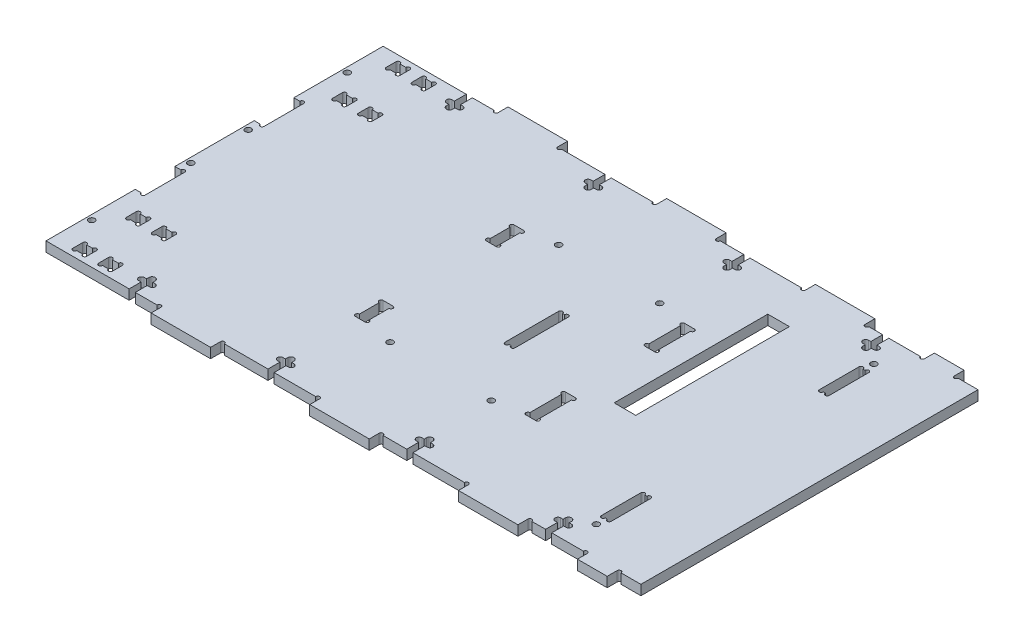
from build123d import *

# Parameters (mm, degrees)
SKETCH_1_W           = 300
SKETCH_1_H           = 170
EXTRUDE_1_DEPTH      = 5
SKETCH_2_W           = 5
SKETCH_2_H           = 27
SKETCH_2_H_2         = 20
CUT_EXTRUDE_1_DEPTH  = 10
SKETCH_3_R           = 1.55
CUT_EXTRUDE_2_DEPTH  = 10
SKETCH_4_W           = 5
SKETCH_4_H           = 20
CUT_EXTRUDE_3_DEPTH  = 5
SKETCH_5_R           = 1
CUT_EXTRUDE_4_DEPTH  = 10
SKETCH_8_W           = 30
SKETCH_8_H           = 5
SKETCH_8_W_2         = 15
EXTRUDE_2_DEPTH      = 5
SKETCH_9_R           = 1
CUT_EXTRUDE_6_DEPTH  = 5
SKETCH_13_W          = 7
SKETCH_13_H          = 5
CUT_EXTRUDE_9_DEPTH  = 10
SKETCH_14_R          = 1
CUT_EXTRUDE_10_DEPTH = 10
SKETCH_15_W          = 5
SKETCH_15_H          = 14
SKETCH_15_H_2        = 20
CUT_EXTRUDE_11_DEPTH = 10
SKETCH_16_R          = 1
CUT_EXTRUDE_12_DEPTH = 10
SKETCH_17_W          = 10.9
SKETCH_17_H          = 77.5
CUT_EXTRUDE_13_DEPTH = 10
CUT_EXTRUDE_5_DEPTH  = 10
SKETCH_18_R          = 6
CUT_EXTRUDE_14_DEPTH = 1.5


with BuildPart() as part:
    # 스케치1 → 보스-돌출1 (new body)
    with BuildSketch(Plane(origin=(0, 0, 0), x_dir=(1, 0, 0), z_dir=(0, 1, 0))):
        with Locations((150, 85)):
            Rectangle(SKETCH_1_W, SKETCH_1_H)
    extrude(amount=EXTRUDE_1_DEPTH)

    # 스케치2 → 컷-돌출1 (cut)
    with BuildSketch(Plane.XZ):
        with Locations((162.5, -85)):
            Rectangle(SKETCH_2_W, SKETCH_2_H)
        with Locations((262.5, -30)):
            Rectangle(SKETCH_2_W, SKETCH_2_H_2)
        with Locations((262.5, -140)):
            Rectangle(SKETCH_2_W, SKETCH_2_H_2)
    extrude(amount=-CUT_EXTRUDE_1_DEPTH, mode=Mode.SUBTRACT)

    # 스케치3 → 컷-돌출2 (cut)
    with BuildSketch(Plane(origin=(0, 5, 0), x_dir=(1, 0, 0), z_dir=(0, 1, 0))):
        with Locations((131, 127.5)):
            Circle(SKETCH_3_R)
        with Locations((182, 127.5)):
            Circle(SKETCH_3_R)
        with Locations((182, 42.5)):
            Circle(SKETCH_3_R)
        with Locations((131, 42.5)):
            Circle(SKETCH_3_R)
        with Locations((2.5, 70.55)):
            Circle(SKETCH_3_R)
        with Locations((2.5, 20.55)):
            Circle(SKETCH_3_R)
        with Locations((2.5, 99.45)):
            Circle(SKETCH_3_R)
        with Locations((2.5, 149.45)):
            Circle(SKETCH_3_R)
        with Locations((262.5, 155)):
            Circle(SKETCH_3_R)
        with Locations((262.5, 15)):
            Circle(SKETCH_3_R)
    extrude(amount=-CUT_EXTRUDE_2_DEPTH, mode=Mode.SUBTRACT)

    # 스케치4 → 컷-돌출3 (cut)
    with BuildSketch(Plane.XZ):
        with Locations((2.5, -115)):
            Rectangle(SKETCH_4_W, SKETCH_4_H)
        with Locations((2.5, -55)):
            Rectangle(SKETCH_4_W, SKETCH_4_H)
    extrude(amount=-CUT_EXTRUDE_3_DEPTH, mode=Mode.SUBTRACT)

    # 스케치5 → 컷-돌출4 (cut)
    with BuildSketch(Plane.XZ):
        with Locations((4, -45)):
            Circle(SKETCH_5_R)
        with Locations((4, -65)):
            Circle(SKETCH_5_R)
        with Locations((4, -105)):
            Circle(SKETCH_5_R)
        with Locations((4, -125)):
            Circle(SKETCH_5_R)
        with Locations((164, -98.5)):
            Circle(SKETCH_5_R)
        with Locations((161, -98.5)):
            Circle(SKETCH_5_R)
        with Locations((164, -71.5)):
            Circle(SKETCH_5_R)
        with Locations((161, -71.5)):
            Circle(SKETCH_5_R)
        with Locations((264, -20)):
            Circle(SKETCH_5_R)
        with Locations((261, -20)):
            Circle(SKETCH_5_R)
        with Locations((264, -40)):
            Circle(SKETCH_5_R)
        with Locations((261, -40)):
            Circle(SKETCH_5_R)
        with Locations((264, -130)):
            Circle(SKETCH_5_R)
        with Locations((261, -130)):
            Circle(SKETCH_5_R)
        with Locations((264, -150)):
            Circle(SKETCH_5_R)
        with Locations((261, -150)):
            Circle(SKETCH_5_R)
    extrude(amount=-CUT_EXTRUDE_4_DEPTH, mode=Mode.SUBTRACT)

    # 스케치8 → 보스-돌출2 (add)
    with BuildSketch(Plane.XZ):
        with Locations((73, 2.5)):
            Rectangle(SKETCH_8_W, SKETCH_8_H)
        with Locations((153, 2.5)):
            Rectangle(SKETCH_8_W, SKETCH_8_H)
        with Locations((228, 2.5)):
            Rectangle(SKETCH_8_W, SKETCH_8_H)
        with Locations((280.5, 2.5)):
            Rectangle(SKETCH_8_W_2, SKETCH_8_H)
        with Locations((280.5, -172.5)):
            Rectangle(SKETCH_8_W_2, SKETCH_8_H)
        with Locations((228, -172.5)):
            Rectangle(SKETCH_8_W, SKETCH_8_H)
        with Locations((153, -172.5)):
            Rectangle(SKETCH_8_W, SKETCH_8_H)
        with Locations((73, -172.5)):
            Rectangle(SKETCH_8_W, SKETCH_8_H)
    extrude(amount=-EXTRUDE_2_DEPTH)

    # 스케치9 → 컷-돌출6 (cut)
    with BuildSketch(Plane.XZ):
        with Locations((57, 0)):
            Circle(SKETCH_9_R)
        with Locations((89, 0)):
            Circle(SKETCH_9_R)
        with Locations((137, 0)):
            Circle(SKETCH_9_R)
        with Locations((169, 0)):
            Circle(SKETCH_9_R)
        with Locations((212, 0)):
            Circle(SKETCH_9_R)
        with Locations((272, 0)):
            Circle(SKETCH_9_R)
        with Locations((244, 0)):
            Circle(SKETCH_9_R)
        with Locations((289, 0)):
            Circle(SKETCH_9_R)
        with Locations((289, -170)):
            Circle(SKETCH_9_R)
        with Locations((244, -170)):
            Circle(SKETCH_9_R)
        with Locations((272, -170)):
            Circle(SKETCH_9_R)
        with Locations((212, -170)):
            Circle(SKETCH_9_R)
        with Locations((169, -170)):
            Circle(SKETCH_9_R)
        with Locations((137, -170)):
            Circle(SKETCH_9_R)
        with Locations((89, -170)):
            Circle(SKETCH_9_R)
        with Locations((57, -170)):
            Circle(SKETCH_9_R)
    extrude(amount=-CUT_EXTRUDE_6_DEPTH, mode=Mode.SUBTRACT)

    # 스케치13 → 컷-돌출9 (cut)
    with BuildSketch(Plane(origin=(0, 5, 0), x_dir=(1, 0, 0), z_dir=(0, 1, 0))):
        with Locations((26.5, 6)):
            Rectangle(SKETCH_13_W, SKETCH_13_H)
        with Locations((13.5, 6)):
            Rectangle(SKETCH_13_W, SKETCH_13_H)
        with Locations((13.5, 33)):
            Rectangle(SKETCH_13_W, SKETCH_13_H)
        with Locations((26.5, 33)):
            Rectangle(SKETCH_13_W, SKETCH_13_H)
        with Locations((26.5, 137)):
            Rectangle(SKETCH_13_W, SKETCH_13_H)
        with Locations((13.5, 137)):
            Rectangle(SKETCH_13_W, SKETCH_13_H)
        with Locations((13.5, 164)):
            Rectangle(SKETCH_13_W, SKETCH_13_H)
        with Locations((26.5, 164)):
            Rectangle(SKETCH_13_W, SKETCH_13_H)
    extrude(amount=-CUT_EXTRUDE_9_DEPTH, mode=Mode.SUBTRACT)

    # 스케치14 → 컷-돌출10 (cut)
    with BuildSketch(Plane.XZ):
        with Locations((11, -8.5)):
            Circle(SKETCH_14_R)
        with Locations((11, -3.5)):
            Circle(SKETCH_14_R)
        with Locations((16, -3.5)):
            Circle(SKETCH_14_R)
        with Locations((16, -8.5)):
            Circle(SKETCH_14_R)
        with Locations((24, -8.5)):
            Circle(SKETCH_14_R)
        with Locations((24, -3.5)):
            Circle(SKETCH_14_R)
        with Locations((29, -3.5)):
            Circle(SKETCH_14_R)
        with Locations((29, -8.5)):
            Circle(SKETCH_14_R)
        with Locations((29, -30.5)):
            Circle(SKETCH_14_R)
        with Locations((29, -35.5)):
            Circle(SKETCH_14_R)
        with Locations((24, -35.5)):
            Circle(SKETCH_14_R)
        with Locations((24, -30.5)):
            Circle(SKETCH_14_R)
        with Locations((16, -30.5)):
            Circle(SKETCH_14_R)
        with Locations((16, -35.5)):
            Circle(SKETCH_14_R)
        with Locations((11, -35.5)):
            Circle(SKETCH_14_R)
        with Locations((11, -30.5)):
            Circle(SKETCH_14_R)
        with Locations((11, -139.5)):
            Circle(SKETCH_14_R)
        with Locations((11, -134.5)):
            Circle(SKETCH_14_R)
        with Locations((16, -134.5)):
            Circle(SKETCH_14_R)
        with Locations((16, -139.5)):
            Circle(SKETCH_14_R)
        with Locations((24, -139.5)):
            Circle(SKETCH_14_R)
        with Locations((24, -134.5)):
            Circle(SKETCH_14_R)
        with Locations((29, -134.5)):
            Circle(SKETCH_14_R)
        with Locations((29, -139.5)):
            Circle(SKETCH_14_R)
        with Locations((29, -161.5)):
            Circle(SKETCH_14_R)
        with Locations((29, -166.5)):
            Circle(SKETCH_14_R)
        with Locations((24, -166.5)):
            Circle(SKETCH_14_R)
        with Locations((24, -161.5)):
            Circle(SKETCH_14_R)
        with Locations((16, -161.5)):
            Circle(SKETCH_14_R)
        with Locations((16, -166.5)):
            Circle(SKETCH_14_R)
        with Locations((11, -166.5)):
            Circle(SKETCH_14_R)
        with Locations((11, -161.5)):
            Circle(SKETCH_14_R)
    extrude(amount=-CUT_EXTRUDE_10_DEPTH, mode=Mode.SUBTRACT)

    # 스케치15 → 컷-돌출11 (cut)
    with BuildSketch(Plane(origin=(0, 5, 0), x_dir=(1, 0, 0), z_dir=(0, 1, 0))):
        with Locations((113.5, 118)):
            Rectangle(SKETCH_15_W, SKETCH_15_H)
        with Locations((113.5, 52)):
            Rectangle(SKETCH_15_W, SKETCH_15_H)
        with Locations((199.5, 55)):
            Rectangle(SKETCH_15_W, SKETCH_15_H_2)
        with Locations((199.5, 115)):
            Rectangle(SKETCH_15_W, SKETCH_15_H_2)
    extrude(amount=-CUT_EXTRUDE_11_DEPTH, mode=Mode.SUBTRACT)

    # 스케치16 → 컷-돌출12 (cut)
    with BuildSketch(Plane(origin=(0, 5, 0), x_dir=(1, 0, 0), z_dir=(0, 1, 0))):
        with Locations((111, 46)):
            Circle(SKETCH_16_R)
        with Locations((116, 46)):
            Circle(SKETCH_16_R)
        with Locations((116, 58)):
            Circle(SKETCH_16_R)
        with Locations((111, 58)):
            Circle(SKETCH_16_R)
        with Locations((111, 112)):
            Circle(SKETCH_16_R)
        with Locations((116, 112)):
            Circle(SKETCH_16_R)
        with Locations((116, 124)):
            Circle(SKETCH_16_R)
        with Locations((111, 124)):
            Circle(SKETCH_16_R)
        with Locations((202, 124)):
            Circle(SKETCH_16_R)
        with Locations((197, 124)):
            Circle(SKETCH_16_R)
        with Locations((197, 64)):
            Circle(SKETCH_16_R)
        with Locations((202, 64)):
            Circle(SKETCH_16_R)
        with Locations((202, 106)):
            Circle(SKETCH_16_R)
        with Locations((197, 106)):
            Circle(SKETCH_16_R)
        with Locations((197, 46)):
            Circle(SKETCH_16_R)
        with Locations((202, 46)):
            Circle(SKETCH_16_R)
    extrude(amount=-CUT_EXTRUDE_12_DEPTH, mode=Mode.SUBTRACT)

    # 스케치17 → 컷-돌출13 (cut)
    with BuildSketch(Plane(origin=(0, 5, 0), x_dir=(1, 0, 0), z_dir=(0, 1, 0))):
        with Locations((219.45, 111.25)):
            Rectangle(SKETCH_17_W, SKETCH_17_H)
    extrude(amount=-CUT_EXTRUDE_13_DEPTH, mode=Mode.SUBTRACT)

    # 스케치7 → 컷-돌출5 (cut)
    with BuildSketch(Plane.XZ):
        with BuildLine():
            Line((115.028741621, -170), (111.928741621, -170))
            Line((111.928741621, -170), (111.928741621, -164))
            Line((111.928741621, -164), (110.728741621, -164))
            ThreePointArc((110.728741621, -164), (109.328741621, -162.6), (110.728741621, -161.2))
            Line((110.728741621, -161.2), (111.928741621, -161.2))
            Line((111.928741621, -161.2), (111.928741621, -160))
            ThreePointArc((111.928741621, -160), (113.478741621, -158.45), (115.028741621, -160))
            Line((115.028741621, -160), (115.028741621, -161.2))
            Line((115.028741621, -161.2), (116.228741621, -161.2))
            ThreePointArc((116.228741621, -161.2), (117.628741621, -162.6), (116.228741621, -164))
            Line((116.228741621, -164), (115.028741621, -164))
            Line((115.028741621, -164), (115.028741621, -170))
        make_face()
        with BuildLine():
            Line((185.028741621, -170), (181.928741621, -170))
            Line((181.928741621, -170), (181.928741621, -164))
            Line((181.928741621, -164), (180.728741621, -164))
            ThreePointArc((180.728741621, -164), (179.328741621, -162.6), (180.728741621, -161.2))
            Line((180.728741621, -161.2), (181.928741621, -161.2))
            Line((181.928741621, -161.2), (181.928741621, -160))
            ThreePointArc((181.928741621, -160), (183.478741621, -158.45), (185.028741621, -160))
            Line((185.028741621, -160), (185.028741621, -161.2))
            Line((185.028741621, -161.2), (186.228741621, -161.2))
            ThreePointArc((186.228741621, -161.2), (187.628741621, -162.6), (186.228741621, -164))
            Line((186.228741621, -164), (185.028741621, -164))
            Line((185.028741621, -164), (185.028741621, -170))
        make_face()
        with BuildLine():
            Line((255.028741621, -170), (251.928741621, -170))
            Line((251.928741621, -170), (251.928741621, -164))
            Line((251.928741621, -164), (250.728741621, -164))
            ThreePointArc((250.728741621, -164), (249.328741621, -162.6), (250.728741621, -161.2))
            Line((250.728741621, -161.2), (251.928741621, -161.2))
            Line((251.928741621, -161.2), (251.928741621, -160))
            ThreePointArc((251.928741621, -160), (253.478741621, -158.45), (255.028741621, -160))
            Line((255.028741621, -160), (255.028741621, -161.2))
            Line((255.028741621, -161.2), (256.228741621, -161.2))
            ThreePointArc((256.228741621, -161.2), (257.628741621, -162.6), (256.228741621, -164))
            Line((256.228741621, -164), (255.028741621, -164))
            Line((255.028741621, -164), (255.028741621, -170))
        make_face()
        with BuildLine():
            Line((46.228741621, -8.8), (45.028741621, -8.8))
            Line((45.028741621, -8.8), (45.028741621, -10))
            ThreePointArc((45.028741621, -10), (43.478741621, -11.55), (41.928741621, -10))
            Line((41.928741621, -10), (41.928741621, -8.8))
            Line((41.928741621, -8.8), (40.728741621, -8.8))
            ThreePointArc((40.728741621, -8.8), (39.328741621, -7.4), (40.728741621, -6))
            Line((40.728741621, -6), (41.928741621, -6))
            Line((41.928741621, -6), (41.928741621, 0))
            Line((41.928741621, 0), (45.028741621, 0))
            Line((45.028741621, 0), (45.028741621, -6))
            Line((45.028741621, -6), (46.228741621, -6))
            ThreePointArc((46.228741621, -6), (47.628741621, -7.4), (46.228741621, -8.8))
        make_face()
        with BuildLine():
            Line((45.028741621, -170), (41.928741621, -170))
            Line((41.928741621, -170), (41.928741621, -164))
            Line((41.928741621, -164), (40.728741621, -164))
            ThreePointArc((40.728741621, -164), (39.328741621, -162.6), (40.728741621, -161.2))
            Line((40.728741621, -161.2), (41.928741621, -161.2))
            Line((41.928741621, -161.2), (41.928741621, -160))
            ThreePointArc((41.928741621, -160), (43.478741621, -158.45), (45.028741621, -160))
            Line((45.028741621, -160), (45.028741621, -161.2))
            Line((45.028741621, -161.2), (46.228741621, -161.2))
            ThreePointArc((46.228741621, -161.2), (47.628741621, -162.6), (46.228741621, -164))
            Line((46.228741621, -164), (45.028741621, -164))
            Line((45.028741621, -164), (45.028741621, -170))
        make_face()
        with BuildLine():
            Line((256.228741621, -8.8), (255.028741621, -8.8))
            Line((255.028741621, -8.8), (255.028741621, -10))
            ThreePointArc((255.028741621, -10), (253.478741621, -11.55), (251.928741621, -10))
            Line((251.928741621, -10), (251.928741621, -8.8))
            Line((251.928741621, -8.8), (250.728741621, -8.8))
            ThreePointArc((250.728741621, -8.8), (249.328741621, -7.4), (250.728741621, -6))
            Line((250.728741621, -6), (251.928741621, -6))
            Line((251.928741621, -6), (251.928741621, 0))
            Line((251.928741621, 0), (255.028741621, 0))
            Line((255.028741621, 0), (255.028741621, -6))
            Line((255.028741621, -6), (256.228741621, -6))
            ThreePointArc((256.228741621, -6), (257.628741621, -7.4), (256.228741621, -8.8))
        make_face()
        with BuildLine():
            Line((186.228741621, -8.8), (185.028741621, -8.8))
            Line((185.028741621, -8.8), (185.028741621, -10))
            ThreePointArc((185.028741621, -10), (183.478741621, -11.55), (181.928741621, -10))
            Line((181.928741621, -10), (181.928741621, -8.8))
            Line((181.928741621, -8.8), (180.728741621, -8.8))
            ThreePointArc((180.728741621, -8.8), (179.328741621, -7.4), (180.728741621, -6))
            Line((180.728741621, -6), (181.928741621, -6))
            Line((181.928741621, -6), (181.928741621, 0))
            Line((181.928741621, 0), (185.028741621, 0))
            Line((185.028741621, 0), (185.028741621, -6))
            Line((185.028741621, -6), (186.228741621, -6))
            ThreePointArc((186.228741621, -6), (187.628741621, -7.4), (186.228741621, -8.8))
        make_face()
        with BuildLine():
            Line((116.228741621, -8.8), (115.028741621, -8.8))
            Line((115.028741621, -8.8), (115.028741621, -10))
            ThreePointArc((115.028741621, -10), (113.478741621, -11.55), (111.928741621, -10))
            Line((111.928741621, -10), (111.928741621, -8.8))
            Line((111.928741621, -8.8), (110.728741621, -8.8))
            ThreePointArc((110.728741621, -8.8), (109.328741621, -7.4), (110.728741621, -6))
            Line((110.728741621, -6), (111.928741621, -6))
            Line((111.928741621, -6), (111.928741621, 0))
            Line((111.928741621, 0), (115.028741621, 0))
            Line((115.028741621, 0), (115.028741621, -6))
            Line((115.028741621, -6), (116.228741621, -6))
            ThreePointArc((116.228741621, -6), (117.628741621, -7.4), (116.228741621, -8.8))
        make_face()
    extrude(amount=-CUT_EXTRUDE_5_DEPTH, mode=Mode.SUBTRACT)

    # 스케치18 → 컷-돌출14 (cut)
    with BuildSketch(Plane.XZ):
        with Locations((15, -17.5)):
            Circle(SKETCH_18_R)
        with Locations((15, -152.5)):
            Circle(SKETCH_18_R)
        with Locations((285, -17.5)):
            Circle(SKETCH_18_R)
        with Locations((285, -152.5)):
            Circle(SKETCH_18_R)
    extrude(amount=-CUT_EXTRUDE_14_DEPTH, mode=Mode.SUBTRACT)


solid = part.part
